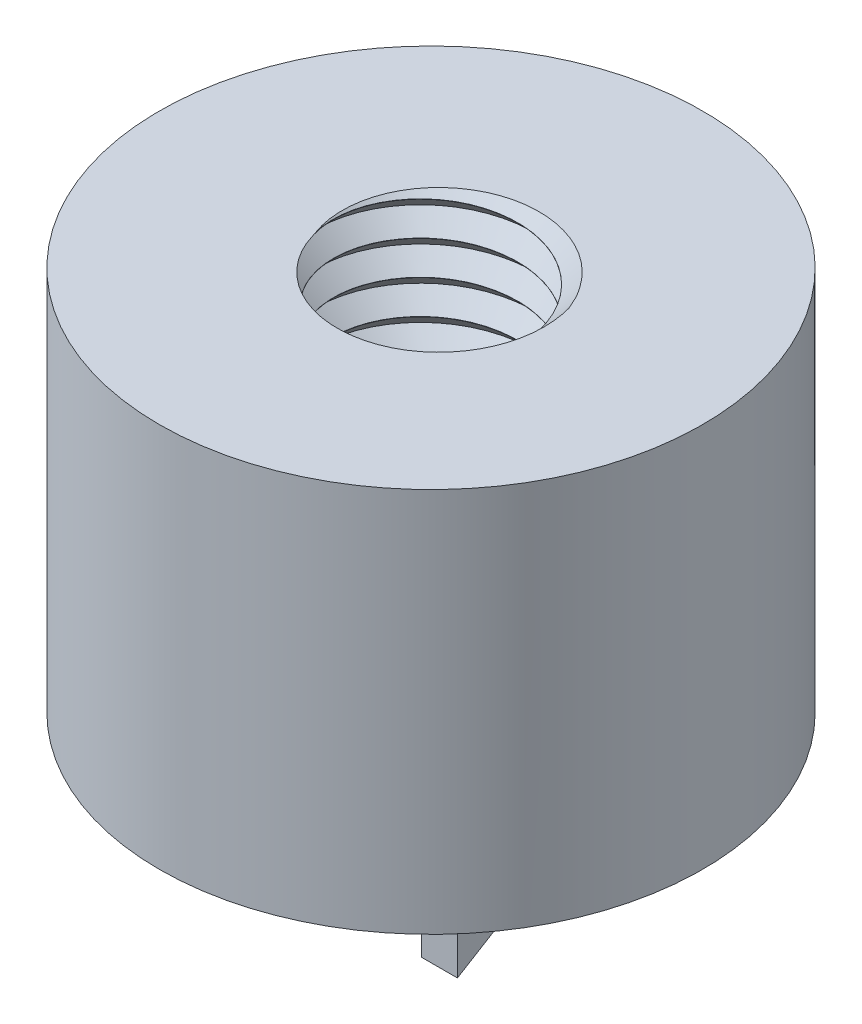
from build123d import *

# Parameters (mm, degrees)
SKETCH_1_W      = 6.6
SKETCH_1_H      = 11
SWEEP_1_PITCH   = 1.25
EXTRUDE_1_DEPTH = 5


with BuildPart() as part:
    # 草图1 → 旋转1 (revolve)
    with BuildSketch(Plane.XY, mode=Mode.PRIVATE) as revolve_1_sk:
        with Locations((6.7, -5.5)):
            Rectangle(SKETCH_1_W, SKETCH_1_H)
    revolve(revolve_1_sk.sketch.rotate(Axis((0, 16.878026906, 0), (0, -1, 0)), 90), axis=Axis((0, 16.878026906, 0), (0, -1, 0)))

    # 切除-扫描1: arcs per turn and ends read off the stored shape
    # 切除-扫描1: the profile of 草图3 profile screwed along a right-hand helix through 11.25 turns, 8 arcs to a turn; built about Z, then put on its axis
    sweep_1_z = Axis((0, 0, 0), (0, 0, 1))
    sweep_1_corners = [(3.3997, 0, -1.8702976), (3.3997, 0, -0.6297024), (4.025, 0, -1.25)]
    with BuildLine(mode=Mode.PRIVATE) as sweep_1_profile:
        Line(sweep_1_corners[0], sweep_1_corners[1])
        Line(sweep_1_corners[1], sweep_1_corners[2])
        Line(sweep_1_corners[2], sweep_1_corners[0])
    sweep_1_cap = Face(sweep_1_profile.wire())
    sweep_1_turn_angles = [0, 22.5, 45, 67.5, 90, 112.5, 135, 157.5, 180, 202.5, 225, 247.5, 270, 292.5, 315, 337.5, 360]
    sweep_1_turn_weights = [1, 0.9238795325112867, 1, 0.9238795325112867, 1, 0.9238795325112867, 1, 0.9238795325112867, 1, 0.9238795325112867, 1, 0.9238795325112867, 1, 0.9238795325112867, 1, 0.9238795325112867, 1]
    sweep_1_turn_rails = [Edge.make_bspline([Vector(p[0], p[1], 0).rotate(sweep_1_z, sweep_1_turn_angles[k]) / sweep_1_turn_weights[k] + Vector(0, 0, p[2] + SWEEP_1_PITCH * sweep_1_turn_angles[k] / 360) for k in range(17)], [0, 0, 0, 1, 1, 2, 2, 3, 3, 4, 4, 5, 5, 6, 6, 7, 7, 8, 8, 8], 2, sweep_1_turn_weights) for p in sweep_1_corners]
    sweep_1_turn_sides = [Face.make_surface_from_curves(sweep_1_turn_rails[p[0]], sweep_1_turn_rails[p[1]]) for p in [(0, 1), (1, 2), (2, 0)]]
    sweep_1_last_angles = [3960, 3982.5, 4005, 4027.5, 4050]
    sweep_1_last_weights = [1, 0.9238795325112867, 1, 0.9238795325112867, 1]
    sweep_1_last_rails = [Edge.make_bspline([Vector(p[0], p[1], 0).rotate(sweep_1_z, sweep_1_last_angles[k]) / sweep_1_last_weights[k] + Vector(0, 0, p[2] + SWEEP_1_PITCH * sweep_1_last_angles[k] / 360) for k in range(5)], [0, 0, 0, 1, 1, 2, 2, 2], 2, sweep_1_last_weights) for p in sweep_1_corners]
    sweep_1_last_sides = [Face.make_surface_from_curves(sweep_1_last_rails[p[0]], sweep_1_last_rails[p[1]]) for p in [(0, 1), (1, 2), (2, 0)]]
    sweep_1 = Plane(origin=(0, -11, 0), x_dir=(0, 0, -1), z_dir=(0, 1, 0)) * Solid(Shell([*[p.moved(Location((0, 0, SWEEP_1_PITCH * i))) for i in range(11) for p in sweep_1_turn_sides], *sweep_1_last_sides, sweep_1_cap, sweep_1_cap.rotate(sweep_1_z, 4050).moved(Location((0, 0, SWEEP_1_PITCH * 4050 / 360)))]))
    add(sweep_1, mode=Mode.SUBTRACT)

    # 草图4 → 旋转2 (revolve)
    with BuildSketch(Plane.XY, mode=Mode.PRIVATE) as revolve_2_sk:
        Polygon((0, -13.323834833), (4.025, -11), (10, -11), (10, -14.182082338), (0, -14.182082338), align=None)
    revolve(revolve_2_sk.sketch.rotate(Axis((0, 0, 0), (0, -1, 0)), 90), axis=Axis((0, 0, 0), (0, -1, 0)))

    # 草图10 → 凸台-拉伸1 (add)
    with BuildSketch(Plane(origin=(0, -14.182082338, 0), x_dir=(-1, 0, 0), z_dir=(0, -1, 0))):
        Polygon((4.174499034, -2.974679615), (2.857425864, -2.974679615), (1.946793242, -0.450289371), (-1.771194563, -0.450289371), (-2.630379014, -2.974679615), (-3.947452185, -2.974679615), (-0.545013161, 6.025320385), (0.662303913, 6.025320385), align=None)
        with BuildLine():
            Line((1.542067632, 0.537515507), (0.187265803, 4.296661848))
            add(Edge.make_bspline(
                [(0.187265803, 4.296661848), (0.176034657, 4.332570358), (0.150397555, 4.414537963), (0.116802283, 4.556009499), (0.083864227, 4.730912366), (0.060836006, 4.858573043), (0.048355742, 4.927759409)],
                knots=[0, 0, 0, 0, 0.697926861, 1.593143037, 2.69559139, 4, 4, 4, 4], degree=3))
            Line((0.048355742, 4.927759409), (0.019201778, 4.927759409))
            add(Edge.make_bspline(
                [(0.019201778, 4.927759409), (0.008707036, 4.863671379), (-0.011118404, 4.742603761), (-0.044584798, 4.572962964), (-0.081846064, 4.426354663), (-0.111250284, 4.33768275), (-0.1248531, 4.296661848)],
                knots=[0, 0, 0, 0, 1.202164453, 2.270988586, 3.200134455, 4, 4, 4, 4], degree=3))
            Line((-0.1248531, 4.296661848), (-1.467650356, 0.537515507))
            Line((-1.467650356, 0.537515507), (1.542067632, 0.537515507))
        make_face(mode=Mode.SUBTRACT)
    extrude(amount=EXTRUDE_1_DEPTH)


solid = part.part
